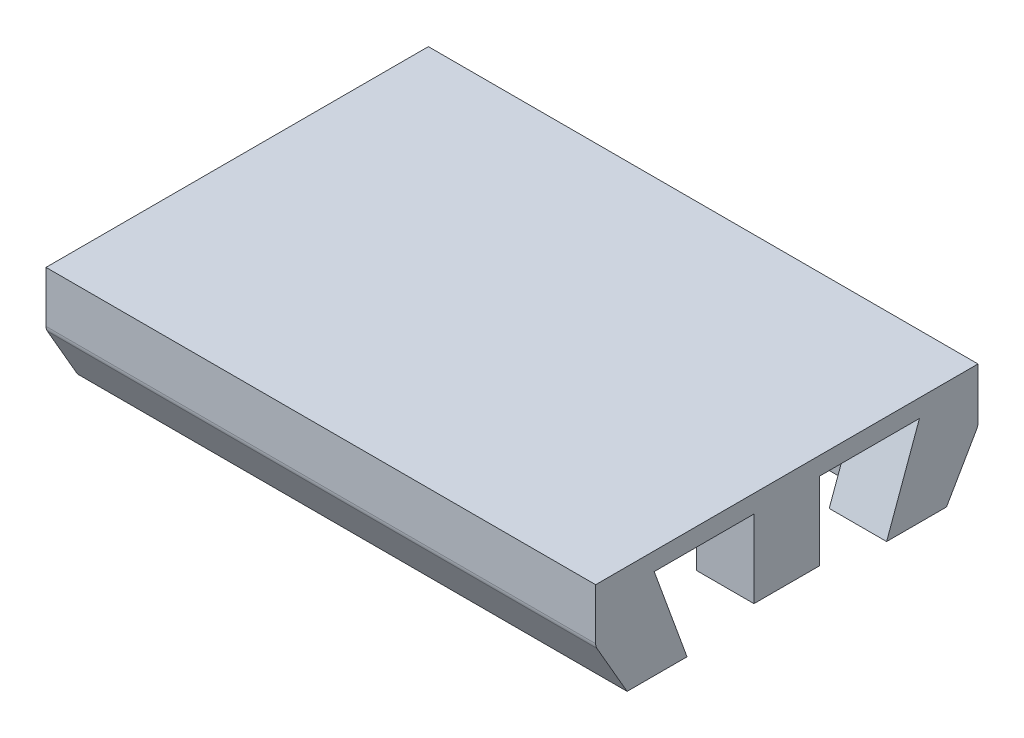
from build123d import *

# Parameters (mm, degrees)
EXTRUDE_340_DEPTH        = 58.419998735
SKETCH_393_W             = 6.985001266
SKETCH_393_H             = 1.333500259
CUT_EXTRUDE_2374_DEPTH   = 55.237557
CUT_EXTRUDE_START        = -9.588525
CUT_EXTRUDE_2430_DEPTH   = 9.588525
SKETCH_5_W               = 6.1
SKETCH_5_H               = 6.985001266
CUT_EXTRUDE_2514_DEPTH   = 1.333524
HOLE_WIZARD_M2_5_1_D     = 2.55
HOLE_WIZARD_M2_5_1_DEPTH = 1
HOLE_WIZARD_M2_5_1_TIP   = 0.766097289
FILLET_1_R               = 1


with BuildPart() as part:
    # Extrude 340: read off the stored shape, not the designer's step
    # Extrude 340 outline → Extrude 340 (new body)
    with BuildSketch(Plane(origin=(0, 0, 0), x_dir=(0, 0, -1), z_dir=(1, 0, 0))):
        Polygon((0, 5.796468934), (0, 11.493524536), (-40.640000254, 11.493524536), (-40.640000254, 5.796468934), (-37.29345587, 0), (-3.346544384, 0), align=None)
    extrude(amount=EXTRUDE_340_DEPTH)

    # Sketch 393 → Cut-Extrude 2374 (cut)
    with BuildSketch(Plane(origin=(58.419998735, 0, 0), x_dir=(0, 0, -1), z_dir=(1, 0, 0))):
        Polygon((-23.81250076, 2.4214e-05), (-23.81250076, 1.333524473), (-23.81250076, 9.588524699), (-34.416999668, 9.588524699), (-30.927071348, 2.4214e-05), align=None)
        with Locations((-20.320000127, 0.666774343)):
            Rectangle(SKETCH_393_W, SKETCH_393_H)
        Polygon((-16.827499494, 9.588524699), (-16.827499494, 1.333524473), (-16.827499494, 2.4214e-05), (-9.712928906, 2.4214e-05), (-6.223000586, 9.588524699), align=None)
    extrude(amount=-CUT_EXTRUDE_2374_DEPTH, mode=Mode.SUBTRACT)

    # Sketch 1050 → Cut-Extrude 2430 (cut)
    with BuildSketch(Plane.XZ.offset(CUT_EXTRUDE_START)):
        Polygon((58.419998735, 23.81250076), (58.419998735, 30.927071348), (52.319998735, 30.927071348), (52.319998735, 34.414733996), (46.209998735, 34.414733996), (46.209998735, 30.927071348), (40.019998735, 30.927071348), (40.019998735, 34.414733996), (33.909998735, 34.414733996), (33.909998735, 30.927071348), (27.719998735, 30.927071348), (27.719998735, 34.414733996), (21.609998735, 34.414733996), (21.609998735, 30.927071348), (15.419998735, 30.927071348), (15.419998735, 34.414733996), (9.309998735, 34.414733996), (9.309998735, 30.927071348), (3.182441867, 30.927071348), (3.182441867, 9.712928906), (9.309998735, 9.712928906), (9.309998735, 6.225266258), (15.419998735, 6.225266258), (15.419998735, 9.712928906), (21.609998735, 9.712928906), (21.609998735, 6.225266258), (27.719998735, 6.225266258), (27.719998735, 9.712928906), (33.909998735, 9.712928906), (33.909998735, 6.225266258), (40.019998735, 6.225266258), (40.019998735, 9.712928906), (46.209998735, 9.712928906), (46.209998735, 6.225266258), (52.319998735, 6.225266258), (52.319998735, 9.712928906), (58.419998735, 9.712928906), (58.419998735, 16.827499494), (52.319998735, 16.827499494), (52.319998735, 23.81250076), align=None)
    extrude(amount=CUT_EXTRUDE_2430_DEPTH, mode=Mode.SUBTRACT)


with BuildPart() as cut_extrude_2430_piece_1:
    # of the separate pieces the step leaves, piece 1, a body of its own (cut_extrude_2430_pieces)
    add(part.part.solids().sort_by_distance((0, 5.796468934, 0))[0])

    # M2.5 螺旋的螺纹孔钻头1
    with Locations(Plane(origin=(0, 4.749824371, 5.079999834), x_dir=(0, 0, -1), z_dir=(-1, 0, 0))):
        with Locations((0, 0), (-30.480000761, 2.389e-06)):
            Hole(HOLE_WIZARD_M2_5_1_D / 2, depth=HOLE_WIZARD_M2_5_1_DEPTH)
            with Locations((0, 0, -(HOLE_WIZARD_M2_5_1_DEPTH + HOLE_WIZARD_M2_5_1_TIP / 2))):  # 118° drill point
                Cone(0, HOLE_WIZARD_M2_5_1_D / 2, HOLE_WIZARD_M2_5_1_TIP, mode=Mode.SUBTRACT)

    # 圆角1
    fillet_1_edges = [cut_extrude_2430_piece_1.edges().sort_by_distance(p)[0] for p in [
        (29.209999368, 5.796468934, 0),
        (29.209999368, 5.796468934, 40.640000254),
    ]]
    fillet(fillet_1_edges, radius=FILLET_1_R)


with BuildPart() as cut_extrude_2430_piece_2:
    # of the separate pieces the step leaves, piece 2, a body of its own (cut_extrude_2430_pieces)
    add(part.part.solids().sort_by_distance((58.419998735, 0, 23.81250076))[0])

    # 顶面开口切面<5> → Cut-Extrude 2514 (cut)
    with BuildSketch(Plane.XZ):
        with Locations((55.369998735, 20.320000127)):
            Rectangle(SKETCH_5_W, SKETCH_5_H)
    extrude(amount=-CUT_EXTRUDE_2514_DEPTH, mode=Mode.SUBTRACT)


solid = cut_extrude_2430_piece_1.part
